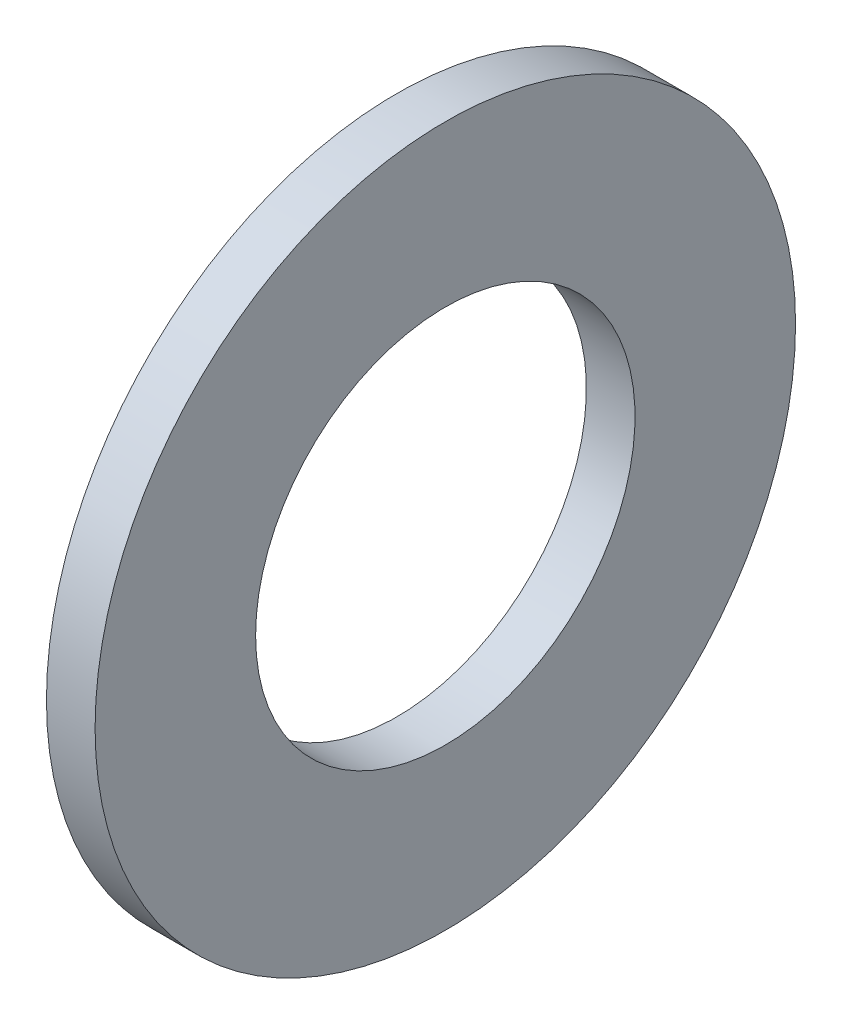
from build123d import *

# Parameters (mm, degrees)
SKETCH1_W = 5
SKETCH1_H = 16.5


with BuildPart() as part:
    # Sketch1 → Base-Revolve (revolve)
    with BuildSketch(Plane.XY):
        with Locations((-2.5, 27.75)):
            Rectangle(SKETCH1_W, SKETCH1_H)
    revolve(axis=Axis((-34.925, 0, 0), (1, 0, 0)))


solid = part.part
